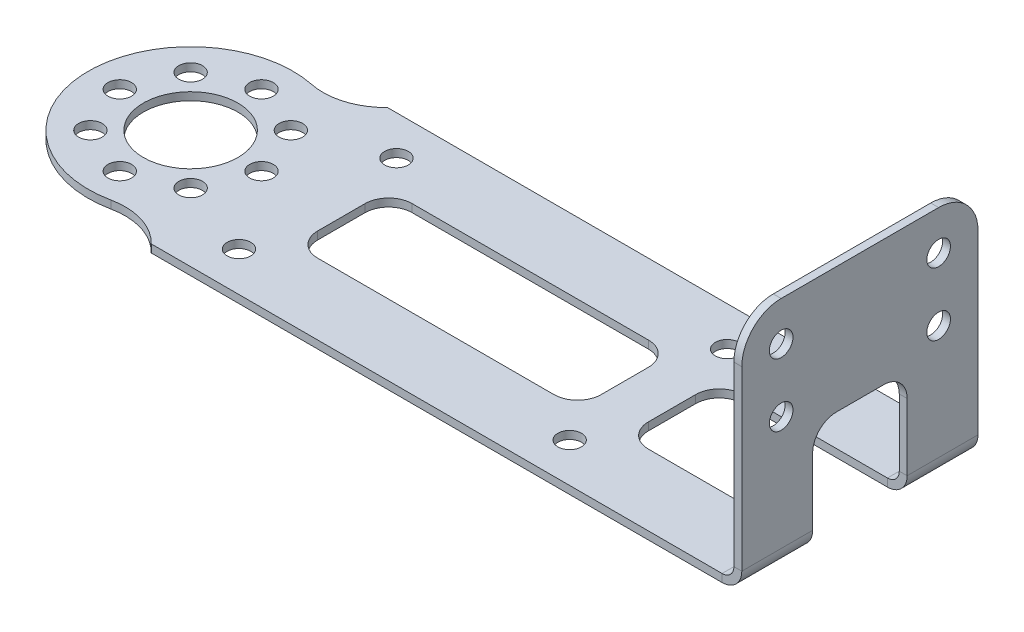
from build123d import *

# Parameters (mm, degrees)
BASE_FLANGE1_DEPTH           = 1
EDGE_FLANGE1_STRIP_W         = 7
EDGE_FLANGE1_STRIP_H         = 1
EDGE_FLANGE1_STRIP_CUT_DEPTH = 30
EDGE_FLANGE1_DEPTH           = 30
FILLET1_R                    = 5
UNFOLD1_OUTLINE_W            = 3.141592654
UNFOLD1_OUTLINE_H            = 30
UNFOLD1_DEPTH                = 29
UNFOLD1_START                = -1
UNFOLD1_2_DEPTH              = 1
SKETCH10_R                   = 6
SKETCH10_R_2                 = 1.5
SKETCH10_W                   = 36
SKETCH10_H                   = 12
CUT_EXTRUDE1_DEPTH           = 10
FILLET2_R                    = 3
FOLD1_START                  = 84.74315
FOLD1_OUTLINE_W              = 1
FOLD1_OUTLINE_H              = 30
FOLD1_DEPTH                  = 28.398442654
FOLD1_START_2                = 82.5
FOLD1_2_OUTLINE_R            = 1.5
FOLD1_2_DEPTH                = 2.5
FOLD1_START_3                = -16
FOLD1_3_DEPTH                = 31


with BuildPart() as part:
    # Base-Flange1: sheet metal written as solids
    # Sketch1 → Base-Flange1 (new body)
    with BuildSketch(Plane(origin=(0, 0, 0), x_dir=(1, 0, 0), z_dir=(0, 1, 0))):
        with BuildLine():
            Line((10, -15), (85, -15))
            Line((85, -15), (85, 15))
            Line((85, 15), (10, 15))
            ThreePointArc((10, 15), (6.607674197, 12.919380101), (2.632597571, 12.730649238))
            ThreePointArc((2.632597571, 12.730649238), (-13, 0), (2.632597571, -12.730649238))
            ThreePointArc((2.632597571, -12.730649238), (6.607674197, -12.919380101), (10, -15))
        make_face()
    extrude(amount=-BASE_FLANGE1_DEPTH)

    # Edge-Flange1: sheet metal written as solids
    # Edge-Flange1 strip (on a plane across the edge) → Edge-Flange1 strip cut (cut)
    with BuildSketch(Plane(origin=(85, 0, 15), x_dir=(-1, 0, 0), z_dir=(0, 0, -1))):
        with Locations((-1, -0.5)):
            Rectangle(EDGE_FLANGE1_STRIP_W, EDGE_FLANGE1_STRIP_H)
    extrude(amount=EDGE_FLANGE1_STRIP_CUT_DEPTH, mode=Mode.SUBTRACT)

    # Edge-Flange1 section (on a plane across the edge) → Edge-Flange1 (add)
    with BuildSketch(Plane(origin=(85, 0, 15), x_dir=(-1, 0, 0), z_dir=(0, 0, -1))):
        with BuildLine():
            Line((0, 1.5), (0, 29))
            Line((0, 29), (1, 29))
            Line((1, 29), (1, 1.5))
            ThreePointArc((1, 1.5), (1.439339828, 0.439339828), (2.5, 0))
            Line((2.5, 0), (2.5, -1))
            ThreePointArc((2.5, -1), (0.732233047, -0.267766953), (0, 1.5))
        make_face()
    extrude(amount=EDGE_FLANGE1_DEPTH)

    # Fillet1
    fillet1_edges = [part.edges().sort_by_distance(p)[0] for p in [
        (84.5, 29, 15),
        (84.5, 29, -15),
    ]]
    fillet(fillet1_edges, radius=FILLET1_R)

    # Unfold1: read off the stored shape, not the designer's step
    # Unfold1 outline → Unfold1 (cut)
    with BuildSketch(Plane(origin=(0, 0, 0), x_dir=(1, 0, 0), z_dir=(0, 1, 0))):
        with Locations((84.070796327, 0)):
            Rectangle(UNFOLD1_OUTLINE_W, UNFOLD1_OUTLINE_H)
    extrude(amount=UNFOLD1_DEPTH, mode=Mode.SUBTRACT)

    # Unfold1 2 outline → Unfold1 2 (add)
    with BuildSketch(Plane(origin=(0, 0, 0), x_dir=(1, 0, 0), z_dir=(0, 1, 0)).offset(UNFOLD1_START)):
        with BuildLine():
            Line((108.141592654, 15), (82.5, 15))
            Line((82.5, 15), (82.5, -15))
            Line((82.5, -15), (108.141592654, -15))
            ThreePointArc((108.141592654, -15), (111.67712656, -13.535533906), (113.141592654, -10))
            Line((113.141592654, -10), (113.141592654, 10))
            ThreePointArc((113.141592654, 10), (111.67712656, 13.535533906), (108.141592654, 15))
        make_face()
    extrude(amount=UNFOLD1_2_DEPTH)

    # Sketch10 → Cut-Extrude1 (cut)
    with BuildSketch(Plane(origin=(0, 0, 0), x_dir=(1, 0, 0), z_dir=(0, 1, 0))):
        with Locations(Location((0, 0, 0), (0, 0, 270))):
            Circle(SKETCH10_R)
        with Locations(Location((0, 9, 0), (0, 0, 270))):
            Circle(SKETCH10_R_2)
        with Locations(Location((6.363961031, 6.363961031, 0), (0, 0, 270))):
            Circle(SKETCH10_R_2)
        with Locations(Location((9, 0, 0), (0, 0, 270))):
            Circle(SKETCH10_R_2)
        with Locations(Location((6.363961031, -6.363961031, 0), (0, 0, 270))):
            Circle(SKETCH10_R_2)
        with Locations(Location((0, -9, 0), (0, 0, 270))):
            Circle(SKETCH10_R_2)
        with Locations(Location((-6.363961031, -6.363961031, 0), (0, 0, 270))):
            Circle(SKETCH10_R_2)
        with Locations(Location((-9, 0, 0), (0, 0, 270))):
            Circle(SKETCH10_R_2)
        with Locations(Location((-6.363961031, 6.363961031, 0), (0, 0, 270))):
            Circle(SKETCH10_R_2)
        with Locations(Location((16.141592654, 10, 0), (0, 0, 270))):
            Circle(SKETCH10_R_2)
        with Locations(Location((16.141592654, -10, 0), (0, 0, 270))):
            Circle(SKETCH10_R_2)
        with Locations(Location((58.141592654, 10, 0), (0, 0, 270))):
            Circle(SKETCH10_R_2)
        with Locations(Location((58.141592654, -10, 0), (0, 0, 270))):
            Circle(SKETCH10_R_2)
        with Locations(Location((100.141592654, 10, 0), (0, 0, 270))):
            Circle(SKETCH10_R_2)
        with Locations(Location((108.141592654, 10, 0), (0, 0, 270))):
            Circle(SKETCH10_R_2)
        with Locations(Location((100.141592654, -10, 0), (0, 0, 270))):
            Circle(SKETCH10_R_2)
        with Locations(Location((108.141592654, -10, 0), (0, 0, 270))):
            Circle(SKETCH10_R_2)
        with Locations((37.141592654, 0)):
            Rectangle(SKETCH10_W, SKETCH10_H)
        with Locations((79.141592654, 0)):
            Rectangle(SKETCH10_W, SKETCH10_H)
    extrude(amount=-CUT_EXTRUDE1_DEPTH, mode=Mode.SUBTRACT)

    # Fillet2
    fillet2_edges = [part.edges().sort_by_distance(p)[0] for p in [
        (97.141592654, -0.5, -6),
        (97.141592654, -0.5, 6),
        (61.141592654, -0.5, 6),
        (61.141592654, -0.5, -6),
        (55.141592654, -0.5, -6),
        (55.141592654, -0.5, 6),
        (19.141592654, -0.5, 6),
        (19.141592654, -0.5, -6),
    ]]
    fillet(fillet2_edges, radius=FILLET2_R)

    # Fold1: read off the stored shape, not the designer's step
    # Fold1 outline → Fold1 (cut)
    with BuildSketch(Plane.YZ.offset(FOLD1_START)):
        with Locations((-0.5, 0)):
            Rectangle(FOLD1_OUTLINE_W, FOLD1_OUTLINE_H)
    extrude(amount=FOLD1_DEPTH, mode=Mode.SUBTRACT)

    # Fold1 2 outline → Fold1 2 (add)
    with BuildSketch(Plane.YZ.offset(FOLD1_START_2)):
        with BuildLine():
            Line((10, -6), (0, -6))
            Line((0, -6), (0, -15))
            Line((0, -15), (24, -15))
            ThreePointArc((24, -15), (27.535533906, -13.535533906), (29, -10))
            Line((29, -10), (29, 10))
            ThreePointArc((29, 10), (27.535533906, 13.535533906), (24, 15))
            Line((24, 15), (0, 15))
            Line((0, 15), (0, 6))
            Line((0, 6), (10, 6))
            ThreePointArc((10, 6), (12.121320344, 5.121320344), (13, 3))
            Line((13, 3), (13, -3))
            ThreePointArc((13, -3), (12.121320344, -5.121320344), (10, -6))
        make_face()
        with Locations((16, -10)):
            Circle(FOLD1_2_OUTLINE_R, mode=Mode.SUBTRACT)
        with Locations((24, -10)):
            Circle(FOLD1_2_OUTLINE_R, mode=Mode.SUBTRACT)
        with Locations((16, 10)):
            Circle(FOLD1_2_OUTLINE_R, mode=Mode.SUBTRACT)
        with Locations((24, 10)):
            Circle(FOLD1_2_OUTLINE_R, mode=Mode.SUBTRACT)
    extrude(amount=FOLD1_2_DEPTH)

    # Fold1 3 outline → Fold1 3 (cut)
    with BuildSketch(Plane.XY.offset(FOLD1_START_3)):
        with BuildLine():
            Line((84, 29), (82.5, 29))
            Line((82.5, 29), (82.5, 0))
            ThreePointArc((82.5, 0), (83.560660172, 0.439339828), (84, 1.5))
            Line((84, 1.5), (84, 29))
        make_face()
        with BuildLine():
            Line((85, 0), (85, 1.5))
            ThreePointArc((85, 1.5), (84.267766953, -0.267766953), (82.5, -1))
            Line((82.5, -1), (84.74315, -1))
            Line((84.74315, -1), (84.74315, 0))
            Line((84.74315, 0), (85, 0))
        make_face()
    extrude(amount=FOLD1_3_DEPTH, mode=Mode.SUBTRACT)


solid = part.part
